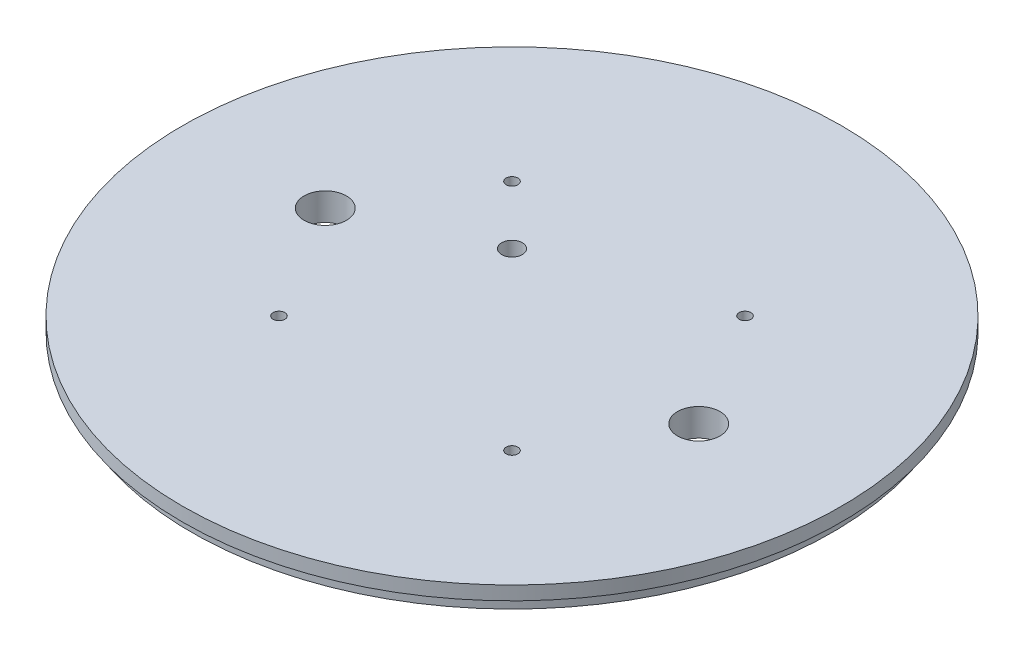
from build123d import *

# Parameters (mm, degrees)
SKETCH1_R           = 76.2
SKETCH1_R_2         = 1.3589
SKETCH1_R_3         = 4.9022
SKETCH1_R_4         = 2.38125
BOSS_EXTRUDE1_DEPTH = 6.35
SKETCH2_R           = 76.2
SKETCH2_R_2         = 74.041
CUT_EXTRUDE1_DEPTH  = 3.175
CUT_EXTRUDE2_START  = -3.175
CUT_EXTRUDE2_DEPTH  = 3.556


with BuildPart() as part:
    # Sketch1 → Boss-Extrude1 (new body)
    with BuildSketch(Plane(origin=(0, 0, 0), x_dir=(1, 0, 0), z_dir=(0, 1, 0))):
        Circle(SKETCH1_R)
        with Locations((-26.940768363, -26.940768363)):
            Circle(SKETCH1_R_2, mode=Mode.SUBTRACT)
        with Locations((26.940768363, -26.940768363)):
            Circle(SKETCH1_R_2, mode=Mode.SUBTRACT)
        with Locations((-43.18, 0)):
            Circle(SKETCH1_R_3, mode=Mode.SUBTRACT)
        with Locations((-13.470384182, 13.470384182)):
            Circle(SKETCH1_R_4, mode=Mode.SUBTRACT)
        with Locations((-26.940768363, 26.940768363)):
            Circle(SKETCH1_R_2, mode=Mode.SUBTRACT)
        with Locations((26.940768363, 26.940768363)):
            Circle(SKETCH1_R_2, mode=Mode.SUBTRACT)
        with Locations((43.18, 0)):
            Circle(SKETCH1_R_3, mode=Mode.SUBTRACT)
    extrude(amount=BOSS_EXTRUDE1_DEPTH)

    # Sketch2 → Cut-Extrude1 (cut)
    with BuildSketch(Plane.XZ):
        Circle(SKETCH2_R)
        Circle(SKETCH2_R_2, mode=Mode.SUBTRACT)
    extrude(amount=-CUT_EXTRUDE1_DEPTH, mode=Mode.SUBTRACT)

    # Sketch3 → Cut-Extrude2 (cut)
    with BuildSketch(Plane(origin=(0, 6.35, 0), x_dir=(1, 0, 0), z_dir=(0, 1, 0)).offset(CUT_EXTRUDE2_START)):
        with BuildLine():
            Line((3.2385, 34.798), (3.2385, 13.97))
            ThreePointArc((3.2385, 13.97), (0, 10.7315), (-3.2385, 13.97))
            Line((-3.2385, 13.97), (-3.2385, 34.798))
            ThreePointArc((-3.2385, 34.798), (0, 38.0365), (3.2385, 34.798))
        make_face()
        with BuildLine():
            Line((3.2385, -34.798), (3.2385, -13.97))
            ThreePointArc((3.2385, -13.97), (0, -10.7315), (-3.2385, -13.97))
            Line((-3.2385, -13.97), (-3.2385, -34.798))
            ThreePointArc((-3.2385, -34.798), (0, -38.0365), (3.2385, -34.798))
        make_face()
    extrude(amount=-CUT_EXTRUDE2_DEPTH, mode=Mode.SUBTRACT)


solid = part.part
